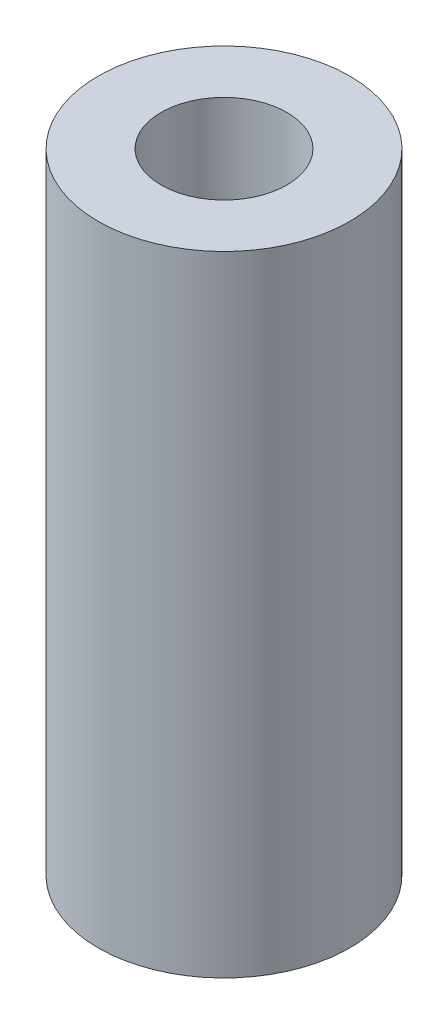
from build123d import *

# Parameters (mm, degrees)
SKETCH1_R           = 50.8
SKETCH1_R_2         = 25.4
BOSS_EXTRUDE1_DEPTH = 254


with BuildPart() as part:
    # Sketch1 → Boss-Extrude1 (new body)
    with BuildSketch(Plane(origin=(0, 0, 0), x_dir=(1, 0, 0), z_dir=(0, 1, 0))):
        Circle(SKETCH1_R)
        Circle(SKETCH1_R_2, mode=Mode.SUBTRACT)
    extrude(amount=BOSS_EXTRUDE1_DEPTH)


solid = part.part
